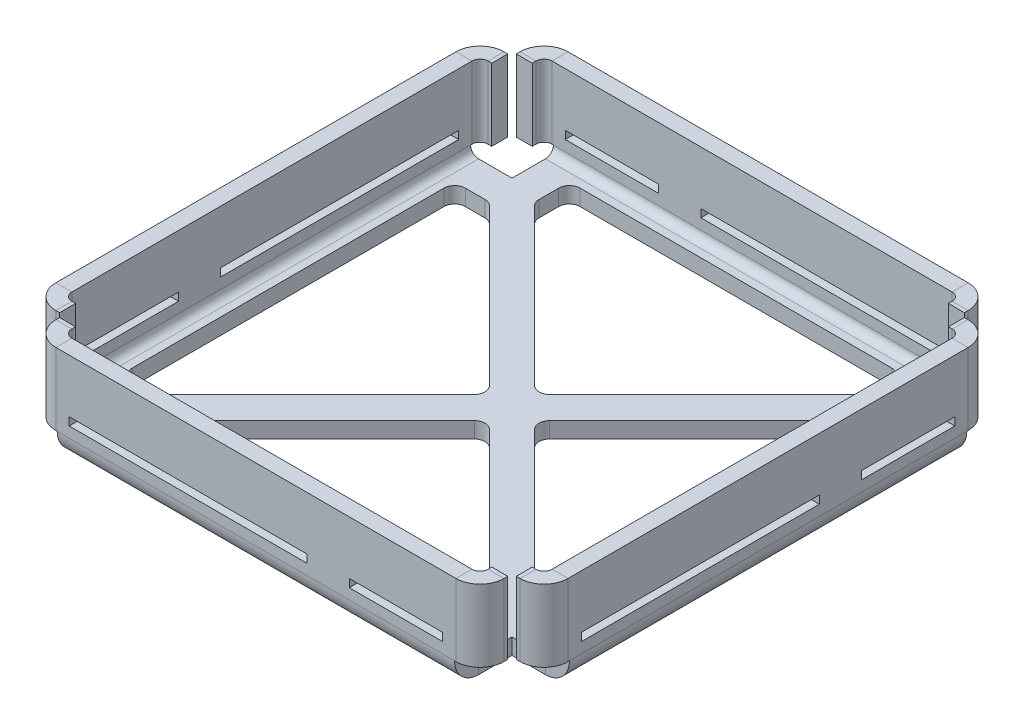
from build123d import *

# Parameters (mm, degrees)
BASE_FLANGE1_DEPTH             = 3
FILLET1_R                      = 2
EDGE_FLANGE1_STRIP_W           = 15
EDGE_FLANGE1_STRIP_H           = 3
EDGE_FLANGE1_STRIP_CUT_DEPTH   = 74.48
EDGE_FLANGE1_STRIP_2_W         = 15
EDGE_FLANGE1_STRIP_2_H         = 3
EDGE_FLANGE1_STRIP_CUT_2_DEPTH = 74.48
EDGE_FLANGE1_STRIP_3_W         = 15
EDGE_FLANGE1_STRIP_3_H         = 3
EDGE_FLANGE1_STRIP_CUT_3_DEPTH = 74.48
EDGE_FLANGE1_STRIP_4_W         = 15
EDGE_FLANGE1_STRIP_4_H         = 3
EDGE_FLANGE1_STRIP_CUT_4_DEPTH = 74.48
EDGE_FLANGE1_DEPTH             = 74.48
EDGE_FLANGE1_BEND_DEPTH        = 74.48
EDGE_FLANGE1_BEND_2_DEPTH      = 74.48
EDGE_FLANGE1_BEND_3_DEPTH      = 74.48
EDGE_FLANGE2_DEPTH             = 13.5
EDGE_FLANGE2_BEND_DEPTH        = 13.5
EDGE_FLANGE2_BEND_2_DEPTH      = 13.5
EDGE_FLANGE2_BEND_3_DEPTH      = 13.5
EDGE_FLANGE2_BEND_4_DEPTH      = 13.5
EDGE_FLANGE2_BEND_5_DEPTH      = 13.5
EDGE_FLANGE2_BEND_6_DEPTH      = 13.5
EDGE_FLANGE2_BEND_7_DEPTH      = 13.5
SKETCH78_W                     = 17.5
SKETCH78_H                     = 1.5
CUT_EXTRUDE1_DEPTH             = 109.671267796
SKETCH79_W                     = 17.5
SKETCH79_H                     = 1.5
CUT_EXTRUDE2_DEPTH             = 110.27488275
CUT_EXTRUDE3_REACH             = 111.275
SKETCH80_W                     = 27.1
SKETCH80_H                     = 1.5
CUT_EXTRUDE4_REACH             = 110.671
SKETCH81_W                     = 27.1
SKETCH81_H                     = 1.5
CUT_EXTRUDE5_REACH             = 111.275
SKETCH82_W                     = 27.1
SKETCH82_H                     = 1.5
CUT_EXTRUDE6_REACH             = 110.671
SKETCH83_W                     = 27.1
SKETCH83_H                     = 1.5


# Sheet-metal steps are written as plain solids
with BuildPart() as part:
    # Sketch1 → Base-Flange1 (new body)
    with BuildSketch(Plane(origin=(0, 0, 0), x_dir=(1, 0, 0), z_dir=(0, 1, 0))):
        Polygon((-50, 36.573333333), (-39.24, 36.573333333), (-39.24, 47.333333333), (35.24, 47.333333333), (35.24, 36.573333333), (46, 36.573333333), (46, -37.906666667), (35.24, -37.906666667), (35.24, -48.666666667), (-39.24, -48.666666667), (-39.24, -37.906666667), (-50, -37.906666667), align=None)
        Polygon((-37.482640687, 30.573333333), (-6.242640687, -0.666666667), (-37.482640687, -31.906666667), (-44, -31.906666667), (-44, 30.573333333), align=None, mode=Mode.SUBTRACT)
        Polygon((-33.24, 34.81597402), (-2, 3.57597402), (29.24, 34.81597402), (29.24, 41.333333333), (-33.24, 41.333333333), align=None, mode=Mode.SUBTRACT)
        Polygon((33.482640687, 30.573333333), (2.242640687, -0.666666667), (33.482640687, -31.906666667), (40, -31.906666667), (40, 30.573333333), align=None, mode=Mode.SUBTRACT)
        Polygon((-33.24, -42.666666667), (-33.24, -36.149307354), (-2, -4.909307354), (29.24, -36.149307354), (29.24, -42.666666667), align=None, mode=Mode.SUBTRACT)
    extrude(amount=-BASE_FLANGE1_DEPTH)

    # Fillet1
    fillet1_edges = [part.edges().sort_by_distance(p)[0] for p in [
        (29.24, -1.5, -41.333333333),
        (29.24, -1.5, -34.81597402),
        (-2, -1.5, -3.57597402),
        (-33.24, -1.5, -34.81597402),
        (-33.24, -1.5, -41.333333333),
        (-44, -1.5, 31.906666667),
        (-44, -1.5, -30.573333333),
        (-37.482640687, -1.5, -30.573333333),
        (-6.242640687, -1.5, 0.666666667),
        (-37.482640687, -1.5, 31.906666667),
        (29.24, -1.5, 42.666666667),
        (-33.24, -1.5, 42.666666667),
        (-33.24, -1.5, 36.149307354),
        (-2, -1.5, 4.909307354),
        (29.24, -1.5, 36.149307354),
        (40, -1.5, -30.573333333),
        (40, -1.5, 31.906666667),
        (33.482640687, -1.5, 31.906666667),
        (2.242640687, -1.5, 0.666666667),
        (33.482640687, -1.5, -30.573333333),
    ]]
    fillet(fillet1_edges, radius=FILLET1_R)

    # Edge-Flange1 strip (across the edge) → Edge-Flange1 strip cut (cut)
    with BuildSketch(Plane(origin=(-50, 0, -36.573333333), x_dir=(1, 0, 0), z_dir=(0, 0, 1))):
        with Locations((-3, -1.5)):
            Rectangle(EDGE_FLANGE1_STRIP_W, EDGE_FLANGE1_STRIP_H)
    extrude(amount=EDGE_FLANGE1_STRIP_CUT_DEPTH, mode=Mode.SUBTRACT)

    # Edge-Flange1 strip 2 (across the edge) → Edge-Flange1 strip cut 2 (cut)
    with BuildSketch(Plane(origin=(46, 0, 37.906666667), x_dir=(-1, 0, 0), z_dir=(0, 0, -1))):
        with Locations((-3, -1.5)):
            Rectangle(EDGE_FLANGE1_STRIP_2_W, EDGE_FLANGE1_STRIP_2_H)
    extrude(amount=EDGE_FLANGE1_STRIP_CUT_2_DEPTH, mode=Mode.SUBTRACT)

    # Edge-Flange1 strip 3 (across the edge) → Edge-Flange1 strip cut 3 (cut)
    with BuildSketch(Plane(origin=(-39.24, 0, 48.666666667), x_dir=(0, 0, -1), z_dir=(1, 0, 0))):
        with Locations((-3, -1.5)):
            Rectangle(EDGE_FLANGE1_STRIP_3_W, EDGE_FLANGE1_STRIP_3_H)
    extrude(amount=EDGE_FLANGE1_STRIP_CUT_3_DEPTH, mode=Mode.SUBTRACT)

    # Edge-Flange1 strip 4 (across the edge) → Edge-Flange1 strip cut 4 (cut)
    with BuildSketch(Plane(origin=(35.24, 0, -47.333333333), x_dir=(0, 0, 1), z_dir=(-1, 0, 0))):
        with Locations((-3, -1.5)):
            Rectangle(EDGE_FLANGE1_STRIP_4_W, EDGE_FLANGE1_STRIP_4_H)
    extrude(amount=EDGE_FLANGE1_STRIP_CUT_4_DEPTH, mode=Mode.SUBTRACT)

    # Edge-Flange1 section (across the edge) → Edge-Flange1 (add)
    with BuildSketch(Plane(origin=(-50, 0, -36.573333333), x_dir=(1, 0, 0), z_dir=(0, 0, 1))):
        with BuildLine():
            Line((0, 1.5), (0, 15))
            Line((0, 15), (3, 15))
            Line((3, 15), (3, 1.5))
            ThreePointArc((3, 1.5), (3.439339828, 0.439339828), (4.5, 0))
            Line((4.5, 0), (4.5, -3))
            ThreePointArc((4.5, -3), (1.318019485, -1.681980515), (0, 1.5))
        make_face()
    extrude(amount=EDGE_FLANGE1_DEPTH)

    # Edge-Flange1 section 2 (across the edge) → Edge-Flange1 bend (add)
    with BuildSketch(Plane(origin=(46, 0, 37.906666667), x_dir=(-1, 0, 0), z_dir=(0, 0, -1))):
        with BuildLine():
            Line((0, 1.5), (0, 15))
            Line((0, 15), (3, 15))
            Line((3, 15), (3, 1.5))
            ThreePointArc((3, 1.5), (3.439339828, 0.439339828), (4.5, 0))
            Line((4.5, 0), (4.5, -3))
            ThreePointArc((4.5, -3), (1.318019485, -1.681980515), (0, 1.5))
        make_face()
    extrude(amount=EDGE_FLANGE1_BEND_DEPTH)

    # Edge-Flange1 section 3 (across the edge) → Edge-Flange1 bend 2 (add)
    with BuildSketch(Plane(origin=(-39.24, 0, 48.666666667), x_dir=(0, 0, -1), z_dir=(1, 0, 0))):
        with BuildLine():
            Line((0, 1.5), (0, 15))
            Line((0, 15), (3, 15))
            Line((3, 15), (3, 1.5))
            ThreePointArc((3, 1.5), (3.439339828, 0.439339828), (4.5, 0))
            Line((4.5, 0), (4.5, -3))
            ThreePointArc((4.5, -3), (1.318019485, -1.681980515), (0, 1.5))
        make_face()
    extrude(amount=EDGE_FLANGE1_BEND_2_DEPTH)

    # Edge-Flange1 section 4 (across the edge) → Edge-Flange1 bend 3 (add)
    with BuildSketch(Plane(origin=(35.24, 0, -47.333333333), x_dir=(0, 0, 1), z_dir=(-1, 0, 0))):
        with BuildLine():
            Line((0, 1.5), (0, 15))
            Line((0, 15), (3, 15))
            Line((3, 15), (3, 1.5))
            ThreePointArc((3, 1.5), (3.439339828, 0.439339828), (4.5, 0))
            Line((4.5, 0), (4.5, -3))
            ThreePointArc((4.5, -3), (1.318019485, -1.681980515), (0, 1.5))
        make_face()
    extrude(amount=EDGE_FLANGE1_BEND_3_DEPTH)

    # Edge-Flange2 section (across the edge) → Edge-Flange2 (add)
    with BuildSketch(Plane(origin=(43, 15, -38.333333333), x_dir=(0, 0, 1), z_dir=(0, -1, 0))):
        with BuildLine():
            Line((-3, 1.5), (-3, 2.2))
            Line((-3, 2.2), (0, 2.2))
            Line((0, 2.2), (0, 1.5))
            ThreePointArc((0, 1.5), (0.439339828, 0.439339828), (1.5, 0))
            Line((1.5, 0), (1.76, 0))
            Line((1.76, 0), (1.76, -3))
            Line((1.76, -3), (1.5, -3))
            ThreePointArc((1.5, -3), (-1.681980515, -1.681980515), (-3, 1.5))
        make_face()
    extrude(amount=EDGE_FLANGE2_DEPTH)

    # Edge-Flange2 section 2 (across the edge) → Edge-Flange2 bend (add)
    with BuildSketch(Plane(origin=(37, 1.5, -44.333333333), x_dir=(-1, 0, 0), z_dir=(0, 1, 0))):
        with BuildLine():
            Line((-3, 1.5), (-3, 2.2))
            Line((-3, 2.2), (0, 2.2))
            Line((0, 2.2), (0, 1.5))
            ThreePointArc((0, 1.5), (0.439339828, 0.439339828), (1.5, 0))
            Line((1.5, 0), (1.76, 0))
            Line((1.76, 0), (1.76, -3))
            Line((1.76, -3), (1.5, -3))
            ThreePointArc((1.5, -3), (-1.681980515, -1.681980515), (-3, 1.5))
        make_face()
    extrude(amount=EDGE_FLANGE2_BEND_DEPTH)

    # Edge-Flange2 section 3 (across the edge) → Edge-Flange2 bend 2 (add)
    with BuildSketch(Plane(origin=(-41, 15, -44.333333333), x_dir=(1, 0, 0), z_dir=(0, -1, 0))):
        with BuildLine():
            Line((-3, 1.5), (-3, 2.2))
            Line((-3, 2.2), (0, 2.2))
            Line((0, 2.2), (0, 1.5))
            ThreePointArc((0, 1.5), (0.439339828, 0.439339828), (1.5, 0))
            Line((1.5, 0), (1.76, 0))
            Line((1.76, 0), (1.76, -3))
            Line((1.76, -3), (1.5, -3))
            ThreePointArc((1.5, -3), (-1.681980515, -1.681980515), (-3, 1.5))
        make_face()
    extrude(amount=EDGE_FLANGE2_BEND_2_DEPTH)

    # Edge-Flange2 section 4 (across the edge) → Edge-Flange2 bend 3 (add)
    with BuildSketch(Plane(origin=(-47, 1.5, -38.333333333), x_dir=(0, 0, 1), z_dir=(0, 1, 0))):
        with BuildLine():
            Line((-3, 1.5), (-3, 2.2))
            Line((-3, 2.2), (0, 2.2))
            Line((0, 2.2), (0, 1.5))
            ThreePointArc((0, 1.5), (0.439339828, 0.439339828), (1.5, 0))
            Line((1.5, 0), (1.76, 0))
            Line((1.76, 0), (1.76, -3))
            Line((1.76, -3), (1.5, -3))
            ThreePointArc((1.5, -3), (-1.681980515, -1.681980515), (-3, 1.5))
        make_face()
    extrude(amount=EDGE_FLANGE2_BEND_3_DEPTH)

    # Edge-Flange2 section 5 (across the edge) → Edge-Flange2 bend 4 (add)
    with BuildSketch(Plane(origin=(-47, 15, 39.666666667), x_dir=(0, 0, -1), z_dir=(0, -1, 0))):
        with BuildLine():
            Line((-3, 1.5), (-3, 2.2))
            Line((-3, 2.2), (0, 2.2))
            Line((0, 2.2), (0, 1.5))
            ThreePointArc((0, 1.5), (0.439339828, 0.439339828), (1.5, 0))
            Line((1.5, 0), (1.76, 0))
            Line((1.76, 0), (1.76, -3))
            Line((1.76, -3), (1.5, -3))
            ThreePointArc((1.5, -3), (-1.681980515, -1.681980515), (-3, 1.5))
        make_face()
    extrude(amount=EDGE_FLANGE2_BEND_4_DEPTH)

    # Edge-Flange2 section 6 (across the edge) → Edge-Flange2 bend 5 (add)
    with BuildSketch(Plane(origin=(-41, 1.5, 45.666666667), x_dir=(1, 0, 0), z_dir=(0, 1, 0))):
        with BuildLine():
            Line((-3, 1.5), (-3, 2.2))
            Line((-3, 2.2), (0, 2.2))
            Line((0, 2.2), (0, 1.5))
            ThreePointArc((0, 1.5), (0.439339828, 0.439339828), (1.5, 0))
            Line((1.5, 0), (1.76, 0))
            Line((1.76, 0), (1.76, -3))
            Line((1.76, -3), (1.5, -3))
            ThreePointArc((1.5, -3), (-1.681980515, -1.681980515), (-3, 1.5))
        make_face()
    extrude(amount=EDGE_FLANGE2_BEND_5_DEPTH)

    # Edge-Flange2 section 7 (across the edge) → Edge-Flange2 bend 6 (add)
    with BuildSketch(Plane(origin=(37, 15, 45.666666667), x_dir=(-1, 0, 0), z_dir=(0, -1, 0))):
        with BuildLine():
            Line((-3, 1.5), (-3, 2.2))
            Line((-3, 2.2), (0, 2.2))
            Line((0, 2.2), (0, 1.5))
            ThreePointArc((0, 1.5), (0.439339828, 0.439339828), (1.5, 0))
            Line((1.5, 0), (1.76, 0))
            Line((1.76, 0), (1.76, -3))
            Line((1.76, -3), (1.5, -3))
            ThreePointArc((1.5, -3), (-1.681980515, -1.681980515), (-3, 1.5))
        make_face()
    extrude(amount=EDGE_FLANGE2_BEND_6_DEPTH)

    # Edge-Flange2 section 8 (across the edge) → Edge-Flange2 bend 7 (add)
    with BuildSketch(Plane(origin=(43, 1.5, 39.666666667), x_dir=(0, 0, -1), z_dir=(0, 1, 0))):
        with BuildLine():
            Line((-3, 1.5), (-3, 2.2))
            Line((-3, 2.2), (0, 2.2))
            Line((0, 2.2), (0, 1.5))
            ThreePointArc((0, 1.5), (0.439339828, 0.439339828), (1.5, 0))
            Line((1.5, 0), (1.76, 0))
            Line((1.76, 0), (1.76, -3))
            Line((1.76, -3), (1.5, -3))
            ThreePointArc((1.5, -3), (-1.681980515, -1.681980515), (-3, 1.5))
        make_face()
    extrude(amount=EDGE_FLANGE2_BEND_7_DEPTH)

    # Sketch78 → Cut-Extrude1 (cut, through all)
    with BuildSketch(Plane(origin=(46, 0, 0), x_dir=(0, 0, -1), z_dir=(1, 0, 0))):
        with Locations((-26.916666667, 4.25)):
            Rectangle(SKETCH78_W, SKETCH78_H)
        with Locations((25.583333333, 4.25)):
            Rectangle(SKETCH78_W, SKETCH78_H)
    extrude(amount=-CUT_EXTRUDE1_DEPTH, mode=Mode.SUBTRACT)

    # Sketch79 → Cut-Extrude2 (cut, through all)
    with BuildSketch(Plane(origin=(0, 0, -47.333333333), x_dir=(-1, 0, 0), z_dir=(0, 0, -1))):
        with Locations((-24.25, 4.25)):
            Rectangle(SKETCH79_W, SKETCH79_H)
        with Locations((28.25, 4.25)):
            Rectangle(SKETCH79_W, SKETCH79_H)
    extrude(amount=-CUT_EXTRUDE2_DEPTH, mode=Mode.SUBTRACT)

    # Sketch80 → Cut-Extrude3 (cut, up to next)
    with BuildSketch(Plane(origin=(0, 0, -47.333333333), x_dir=(-1, 0, 0), z_dir=(0, 0, -1)), mode=Mode.PRIVATE) as cut_extrude3_sk1:
        with Locations((-1.95, 4.25)):
            Rectangle(SKETCH80_W, SKETCH80_H)
    cut_extrude3_tool1 = extrude(cut_extrude3_sk1.sketch, amount=-CUT_EXTRUDE3_REACH, mode=Mode.PRIVATE) & part.part
    add(cut_extrude3_tool1.solids().sort_by_distance((1.95, 4.25, -47.333333))[0], mode=Mode.SUBTRACT)

    # Sketch81 → Cut-Extrude4 (cut, up to next)
    with BuildSketch(Plane(origin=(46, 0, 0), x_dir=(0, 0, -1), z_dir=(1, 0, 0)), mode=Mode.PRIVATE) as cut_extrude4_sk1:
        with Locations((-4.616666667, 4.25)):
            Rectangle(SKETCH81_W, SKETCH81_H)
    cut_extrude4_tool1 = extrude(cut_extrude4_sk1.sketch, amount=-CUT_EXTRUDE4_REACH, mode=Mode.PRIVATE) & part.part
    add(cut_extrude4_tool1.solids().sort_by_distance((46, 4.25, 4.616667))[0], mode=Mode.SUBTRACT)

    # Sketch82 → Cut-Extrude5 (cut, up to next)
    with BuildSketch(Plane.XY.offset(48.666666667), mode=Mode.PRIVATE) as cut_extrude5_sk1:
        with Locations((-5.95, 4.25)):
            Rectangle(SKETCH82_W, SKETCH82_H)
    cut_extrude5_tool1 = extrude(cut_extrude5_sk1.sketch, amount=-CUT_EXTRUDE5_REACH, mode=Mode.PRIVATE) & part.part
    add(cut_extrude5_tool1.solids().sort_by_distance((-5.95, 4.25, 48.666667))[0], mode=Mode.SUBTRACT)

    # Sketch83 → Cut-Extrude6 (cut, up to next)
    with BuildSketch(Plane.ZY.offset(50), mode=Mode.PRIVATE) as cut_extrude6_sk1:
        with Locations((-3.283333333, 4.25)):
            Rectangle(SKETCH83_W, SKETCH83_H)
    cut_extrude6_tool1 = extrude(cut_extrude6_sk1.sketch, amount=-CUT_EXTRUDE6_REACH, mode=Mode.PRIVATE) & part.part
    add(cut_extrude6_tool1.solids().sort_by_distance((-50, 4.25, -3.283333))[0], mode=Mode.SUBTRACT)


solid = part.part
